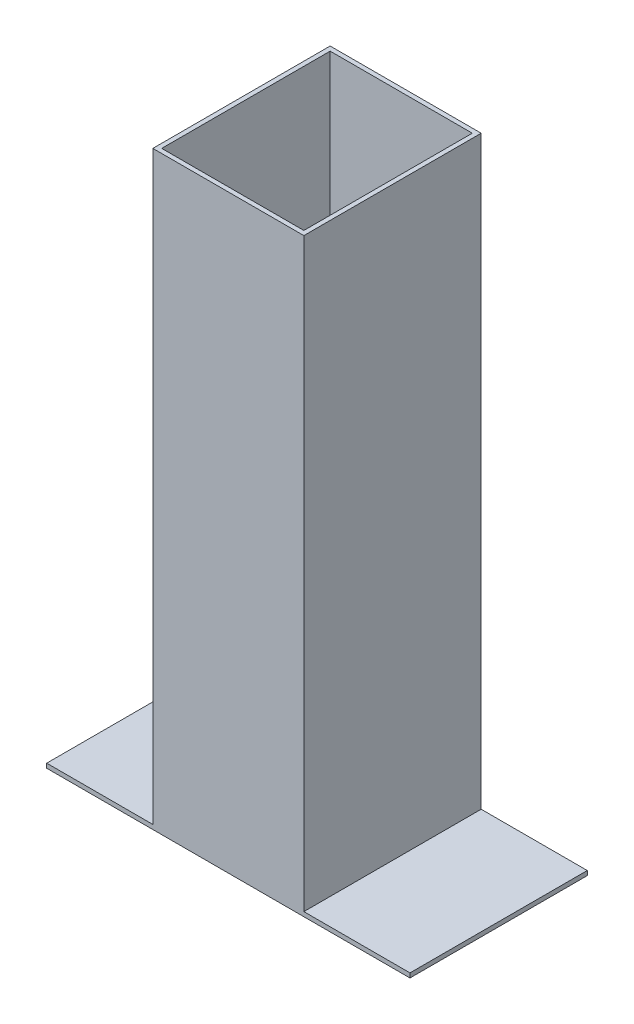
from build123d import *

# Parameters (mm, degrees)
BOSS_EXTRUDE1_DEPTH = 127
SKETCH3_W           = 203.65
SKETCH3_H           = 241.3
CUT_EXTRUDE1_DEPTH  = 1000


with BuildPart() as part:
    # Sketch2 → Boss-Extrude1 (new, symmetric)
    with BuildSketch(Plane.XY):
        Polygon((-108.175, 0), (108.175, 0), (260.175, 0), (260.175, 6.35), (108.175, 6.35), (108.175, 845), (-108.175, 845), (-108.175, 6.35), (-260.175, 6.35), (-260.175, 0), align=None)
    extrude(amount=BOSS_EXTRUDE1_DEPTH, both=True)

    # Sketch3 → Cut-Extrude1 (cut)
    with BuildSketch(Plane(origin=(0, 845, 0), x_dir=(1, 0, 0), z_dir=(0, 1, 0))):
        Rectangle(SKETCH3_W, SKETCH3_H)
    extrude(amount=-CUT_EXTRUDE1_DEPTH, mode=Mode.SUBTRACT)


solid = part.part
